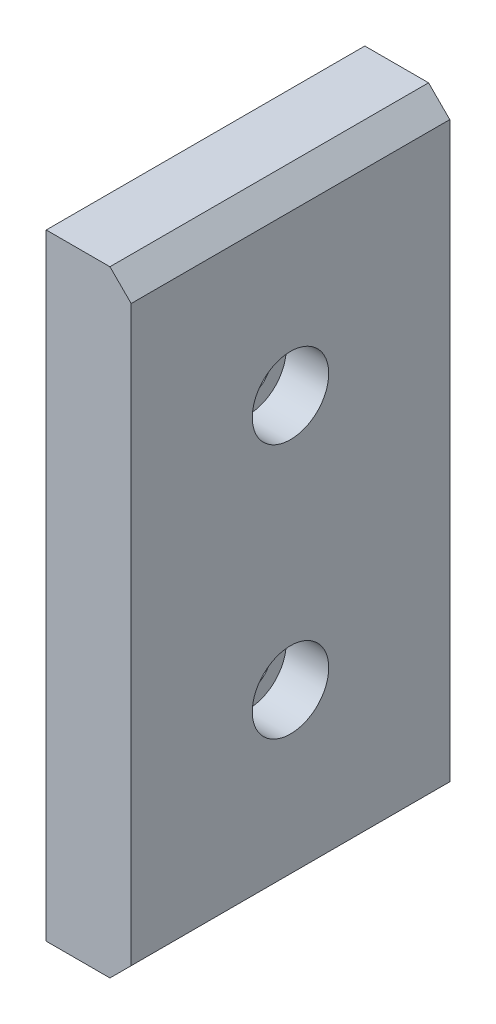
from build123d import *

# Parameters (mm, degrees)
SKETCH_1_W          = 15
SKETCH_1_H          = 29
SKETCH_1_R          = 1.1
EXTRUDE_1_DEPTH     = 4
SKETCH_2_R          = 1.8
CUT_EXTRUDE_1_DEPTH = 2
CHAMFER_1_SIZE      = 1


with BuildPart() as part:
    # Эскиз1 → Бобышка-Вытянуть1 (new body)
    with BuildSketch(Plane(origin=(0, 0, 0), x_dir=(0, 0, -1), z_dir=(1, 0, 0))):
        Rectangle(SKETCH_1_W, SKETCH_1_H)
        with Locations((0, 6)):
            Circle(SKETCH_1_R, mode=Mode.SUBTRACT)
        with Locations((0, -6)):
            Circle(SKETCH_1_R, mode=Mode.SUBTRACT)
    extrude(amount=EXTRUDE_1_DEPTH)

    # Эскиз2 → Вырез-Вытянуть1 (cut)
    with BuildSketch(Plane(origin=(4, 0, 0), x_dir=(0, 0, -1), z_dir=(1, 0, 0))):
        with Locations((0, 6)):
            Circle(SKETCH_2_R)
        with Locations((0, -6)):
            Circle(SKETCH_2_R)
    extrude(amount=-CUT_EXTRUDE_1_DEPTH, mode=Mode.SUBTRACT)

    # Фаска1
    chamfer_1_edges = [part.edges().sort_by_distance(p)[0] for p in [
        (4, -14.5, 0),
        (4, 14.5, 0),
    ]]
    chamfer(chamfer_1_edges, length=CHAMFER_1_SIZE)


solid = part.part
